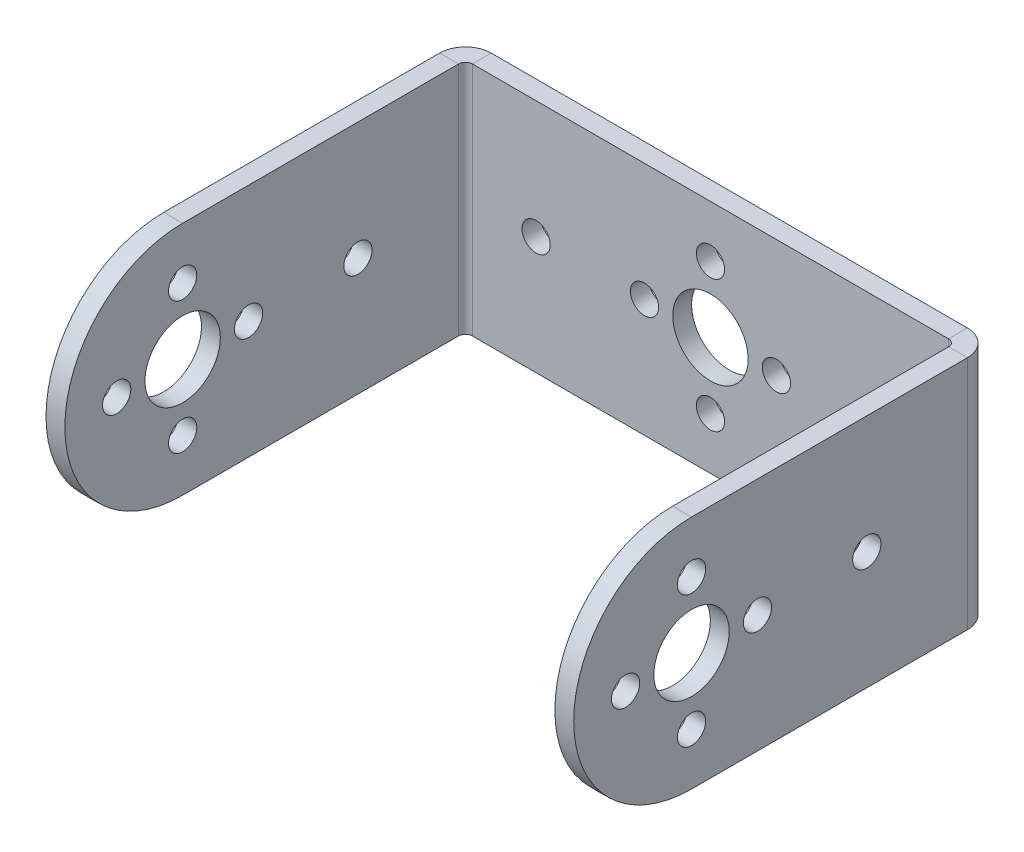
from build123d import *

# Parameters (mm, degrees)
SKETCH_1_W                         = 54
SKETCH_1_H                         = 25
SKETCH_1_R                         = 4
SKETCH_1_R_2                       = 1.5
SM_BASE_FLANGE_1_DEPTH             = 2
SM_EDGE_FLANGE_1_STRIP_W           = 10.4732
SM_EDGE_FLANGE_1_STRIP_H           = 2
SM_EDGE_FLANGE_1_STRIP_CUT_DEPTH   = 25
SM_EDGE_FLANGE_1_STRIP_2_W         = 10.4732
SM_EDGE_FLANGE_1_STRIP_2_H         = 2
SM_EDGE_FLANGE_1_STRIP_CUT_2_DEPTH = 25
SM_EDGE_FLANGE_1_DEPTH             = 25
SM_EDGE_FLANGE_1_BEND_DEPTH        = 25
CUT_EXTRUDE_2_DEPTH                = 76.771036683
SKETCH_13_R                        = 4
SKETCH_13_R_2                      = 1.5
CUT_EXTRUDE_3_DEPTH                = 75.619515469


# Sheet-metal steps are written as plain solids
with BuildPart() as part:
    # Sketch 1 → 基体-法兰1 (new body)
    with BuildSketch(Plane.XY):
        with Locations((27, -12.5)):
            Rectangle(SKETCH_1_W, SKETCH_1_H)
        with Locations((27, -12.5)):
            Circle(SKETCH_1_R, mode=Mode.SUBTRACT)
        with Locations((27, -5.5)):
            Circle(SKETCH_1_R_2, mode=Mode.SUBTRACT)
        with Locations((27, -19.5)):
            Circle(SKETCH_1_R_2, mode=Mode.SUBTRACT)
        with Locations((34, -12.5)):
            Circle(SKETCH_1_R_2, mode=Mode.SUBTRACT)
        with Locations((20, -12.5)):
            Circle(SKETCH_1_R_2, mode=Mode.SUBTRACT)
        with Locations((45.5, -12.5)):
            Circle(SKETCH_1_R_2, mode=Mode.SUBTRACT)
        with Locations((8.5, -12.5)):
            Circle(SKETCH_1_R_2, mode=Mode.SUBTRACT)
    extrude(amount=-SM_BASE_FLANGE_1_DEPTH)

    # 边线-法兰1 strip (across the edge) → 边线-法兰1 strip cut (cut)
    with BuildSketch(Plane(origin=(-1, 0, 0), x_dir=(1, 0, 0), z_dir=(0, -1, 0))):
        with Locations((-2.5, -1)):
            Rectangle(SM_EDGE_FLANGE_1_STRIP_W, SM_EDGE_FLANGE_1_STRIP_H)
    extrude(amount=SM_EDGE_FLANGE_1_STRIP_CUT_DEPTH, mode=Mode.SUBTRACT)

    # 边线-法兰1 strip 2 (across the edge) → 边线-法兰1 strip cut 2 (cut)
    with BuildSketch(Plane(origin=(55, -25, 0), x_dir=(-1, 0, 0), z_dir=(0, 1, 0))):
        with Locations((-2.5, -1)):
            Rectangle(SM_EDGE_FLANGE_1_STRIP_2_W, SM_EDGE_FLANGE_1_STRIP_2_H)
    extrude(amount=SM_EDGE_FLANGE_1_STRIP_CUT_2_DEPTH, mode=Mode.SUBTRACT)

    # 边线-法兰1 section (across the edge) → 边线-法兰1 (add)
    with BuildSketch(Plane(origin=(-1, 0, 0), x_dir=(1, 0, 0), z_dir=(0, -1, 0))):
        with BuildLine():
            Line((0, 0.7366), (0, 44.5))
            Line((0, 44.5), (2, 44.5))
            Line((2, 44.5), (2, 0.7366))
            ThreePointArc((2, 0.7366), (2.215745145, 0.215745145), (2.7366, 0))
            Line((2.7366, 0), (2.7366, -2))
            ThreePointArc((2.7366, -2), (0.801531583, -1.198468417), (0, 0.7366))
        make_face()
    extrude(amount=SM_EDGE_FLANGE_1_DEPTH)

    # 边线-法兰1 section 2 (across the edge) → 边线-法兰1 bend (add)
    with BuildSketch(Plane(origin=(55, -25, 0), x_dir=(-1, 0, 0), z_dir=(0, 1, 0))):
        with BuildLine():
            Line((0, 0.7366), (0, 44.5))
            Line((0, 44.5), (2, 44.5))
            Line((2, 44.5), (2, 0.7366))
            ThreePointArc((2, 0.7366), (2.215745145, 0.215745145), (2.7366, 0))
            Line((2.7366, 0), (2.7366, -2))
            ThreePointArc((2.7366, -2), (0.801531583, -1.198468417), (0, 0.7366))
        make_face()
    extrude(amount=SM_EDGE_FLANGE_1_BEND_DEPTH)

    # 草图12 → 切除-拉伸2 (cut, through all)
    with BuildSketch(Plane(origin=(55, 0, 0), x_dir=(0, 0, -1), z_dir=(1, 0, 0))):
        with BuildLine():
            ThreePointArc((-30.009670534, -25), (-42.509670534, -12.5), (-30.009670534, 0))
            Line((-30.009670534, 0), (-44.5, 0))
            Line((-44.5, 0), (-44.5, -25))
            Line((-44.5, -25), (-30.009670534, -25))
        make_face()
    extrude(amount=-CUT_EXTRUDE_2_DEPTH, mode=Mode.SUBTRACT)

    # 草图13 → 切除-拉伸3 (cut, through all)
    with BuildSketch(Plane(origin=(55, 0, 0), x_dir=(0, 0, -1), z_dir=(1, 0, 0))):
        with Locations((-30.009670534, -12.5)):
            Circle(SKETCH_13_R)
        with Locations((-30.009670534, -19.5)):
            Circle(SKETCH_13_R_2)
        with Locations((-37.009670534, -12.5)):
            Circle(SKETCH_13_R_2)
        with Locations((-30.009670534, -5.5)):
            Circle(SKETCH_13_R_2)
        with Locations((-23.009670534, -12.5)):
            Circle(SKETCH_13_R_2)
        with Locations((-11.409670534, -12.5)):
            Circle(SKETCH_13_R_2)
    extrude(amount=-CUT_EXTRUDE_3_DEPTH, mode=Mode.SUBTRACT)


solid = part.part
